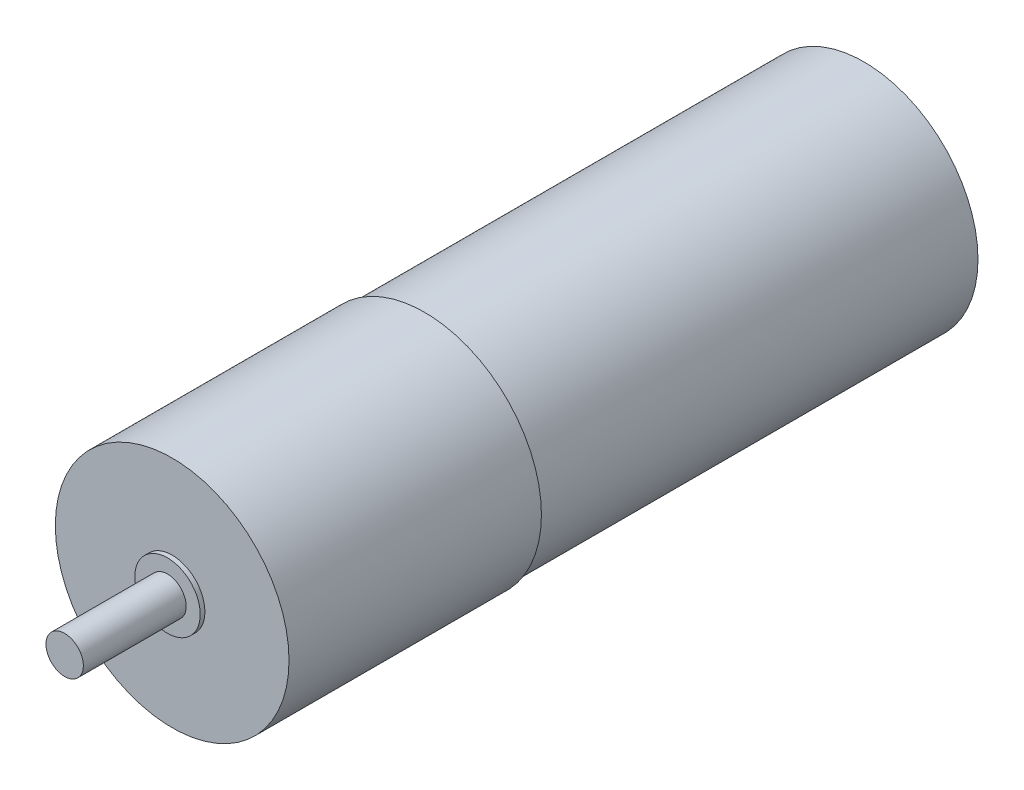
from build123d import *

# Parameters (mm, degrees)
SKETCH3_R           = 12.2
BOSS_EXTRUDE1_DEPTH = 47
SKETCH4_R           = 12.5
BOSS_EXTRUDE2_DEPTH = 27
SKETCH5_R           = 3.5
BOSS_EXTRUDE3_DEPTH = 0.5
SKETCH6_R           = 2
BOSS_EXTRUDE4_DEPTH = 11


with BuildPart() as part:
    # Sketch3 → Boss-Extrude1 (new body)
    with BuildSketch(Plane.XY):
        Circle(SKETCH3_R)
    extrude(amount=BOSS_EXTRUDE1_DEPTH)

    # Sketch4 → Boss-Extrude2 (add)
    with BuildSketch(Plane.XY.offset(47)):
        Circle(SKETCH4_R)
    extrude(amount=BOSS_EXTRUDE2_DEPTH)

    # Sketch5 → Boss-Extrude3 (add)
    with BuildSketch(Plane.XY.offset(74)):
        Circle(SKETCH5_R)
    extrude(amount=BOSS_EXTRUDE3_DEPTH)

    # Sketch6 → Boss-Extrude4 (add)
    with BuildSketch(Plane.XY.offset(74.5)):
        Circle(SKETCH6_R)
    extrude(amount=BOSS_EXTRUDE4_DEPTH)


solid = part.part
